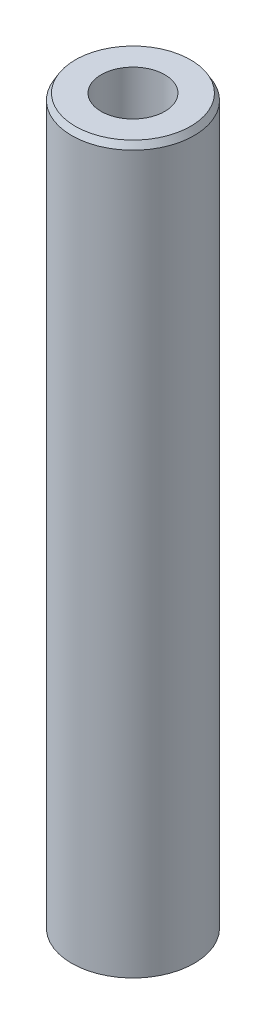
from build123d import *
from OCP.BRepFilletAPI import BRepFilletAPI_MakeChamfer

# Parameters (mm, degrees)
SKETCH1_R           = 42.5
BOSS_EXTRUDE1_DEPTH = 504.373598416
SKETCH2_R           = 22.091964665
CUT_EXTRUDE1_DEPTH  = 508.942149048
CHAMFER1_SIZE       = 4.318825763
CHAMFER1_SIZE2      = 2.493475217


with BuildPart() as part:
    # Sketch1 → Boss-Extrude1 (new body)
    with BuildSketch(Plane(origin=(0, 0, 0), x_dir=(1, 0, 0), z_dir=(0, 1, 0))):
        Circle(SKETCH1_R)
    extrude(amount=BOSS_EXTRUDE1_DEPTH)

    # Sketch2 → Cut-Extrude1 (cut, through all)
    with BuildSketch(Plane(origin=(0, 0, 0), x_dir=(1, 0, 0), z_dir=(0, 1, 0))):
        Circle(SKETCH2_R)
    extrude(amount=CUT_EXTRUDE1_DEPTH, mode=Mode.SUBTRACT)

    # Chamfer1: one chamfer whose edges measure the first distance from different faces: ONE call of the kernel's chamfer builder (chamfer() names one face for all edges)
    chamfer1_edges_1 = [part.edges().sort_by_distance(p)[0] for p in [
        (-42.5, 504.373598416, 0),
    ]]
    chamfer1_side_1 = [part.faces().sort_by_distance(p)[0] for p in [
        (-42.5, 252.186799208, 0),
    ]]
    chamfer1_edges_2 = [part.edges().sort_by_distance(p)[0] for p in [
        (-42.5, 0, 0),
    ]]
    chamfer1_side_2 = [part.faces().sort_by_distance(p)[0] for p in [
        (-41.297918472, 0, 0),
    ]]
    chamfer1 = BRepFilletAPI_MakeChamfer(part.part.solid().wrapped)
    for e in chamfer1_edges_1:
        chamfer1.Add(CHAMFER1_SIZE, CHAMFER1_SIZE2, e.wrapped, chamfer1_side_1[0].wrapped)  # the first distance lies on this face
    for e in chamfer1_edges_2:
        chamfer1.Add(CHAMFER1_SIZE, CHAMFER1_SIZE2, e.wrapped, chamfer1_side_2[0].wrapped)  # the first distance lies on this face
    add(Compound.cast(chamfer1.Shape()), mode=Mode.REPLACE)


solid = part.part
